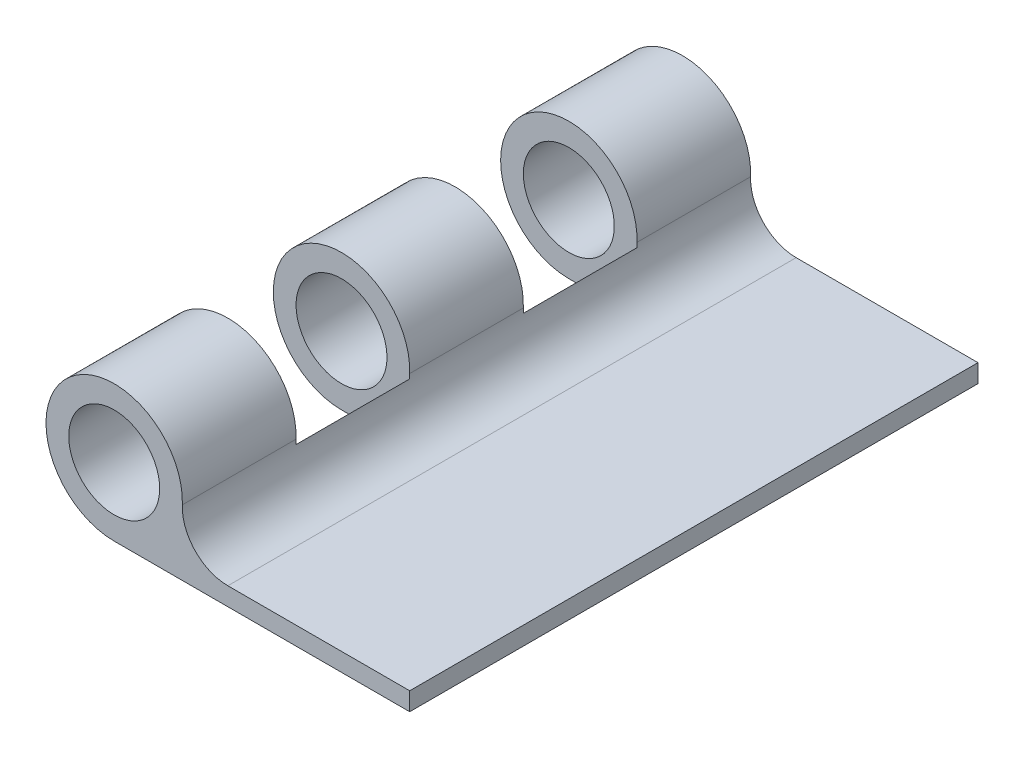
from build123d import *

# Parameters (mm, degrees)
ESBO_O1_R                = 2
RESSALTO_EXTRUS_O1_DEPTH = 25
ESBO_O2_W                = 6
ESBO_O2_H                = 5
CORTE_EXTRUS_O1_DEPTH    = 31.282007859


with BuildPart() as part:
    # Esboço1 → Ressalto-extrusão1 (new body)
    with BuildSketch(Plane.XY):
        with BuildLine():
            Line((0, 0), (-13, 0))
            ThreePointArc((-13, 0), (-15.999893576, 3.02526917), (-12.949463452, 5.999574313))
            ThreePointArc((-12.949463452, 5.999574313), (-10.820063237, 5.061037532), (-10.002305919, 2.882398155))
            ThreePointArc((-10.002305919, 2.882398155), (-9.444438565, 1.414962919), (-8, 0.8))
            Line((-8, 0.8), (0, 0.8))
            Line((0, 0.8), (0, 0))
        make_face()
        with Locations((-13, 3)):
            Circle(ESBO_O1_R, mode=Mode.SUBTRACT)
    extrude(amount=RESSALTO_EXTRUS_O1_DEPTH)

    # Esboço2 → Corte-extrusão1 (cut, through all)
    with BuildSketch(Plane.XZ):
        with Locations((-13, 7.5)):
            Rectangle(ESBO_O2_W, ESBO_O2_H)
        with Locations((-13, 17.5)):
            Rectangle(ESBO_O2_W, ESBO_O2_H)
        with Locations((-13, 27.5)):
            Rectangle(ESBO_O2_W, ESBO_O2_H)
    extrude(amount=-CORTE_EXTRUS_O1_DEPTH, mode=Mode.SUBTRACT)


solid = part.part
